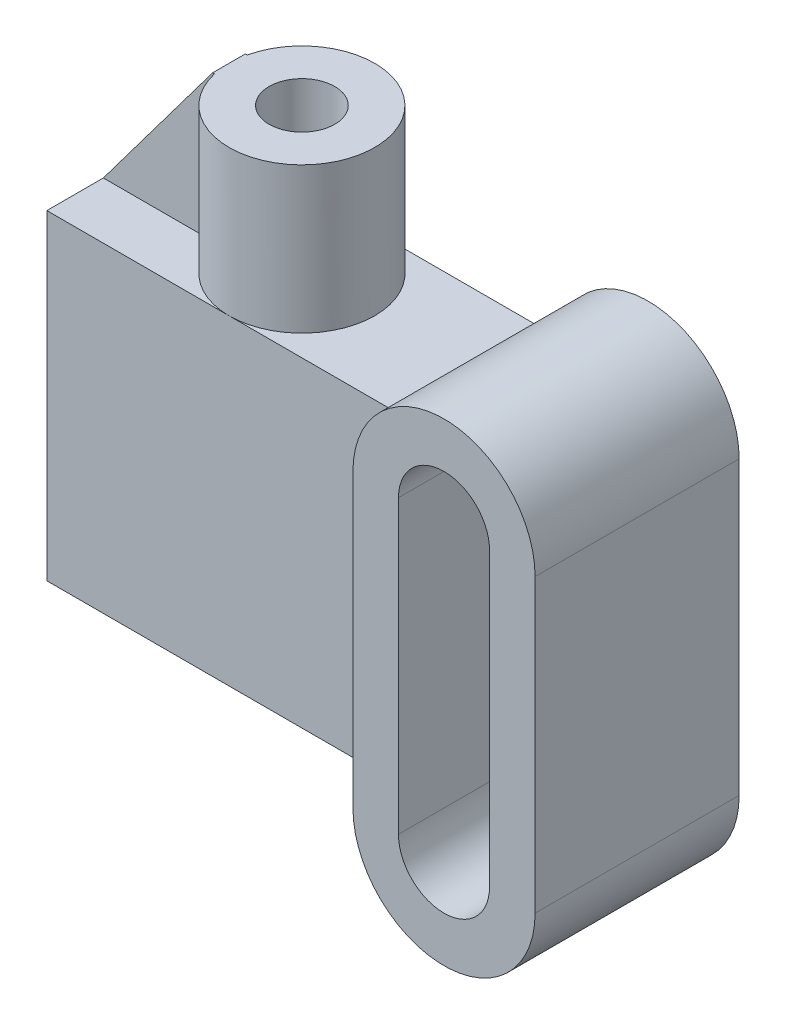
from build123d import *

# Parameters (mm, degrees)
BOSS_EXTRUDE1_DEPTH        = 56
BOSS_EXTRUDE2_START        = -0.322075
BOSS_EXTRUDE2_DEPTH        = 100.322075
SKETCH5_R                  = 20
BOSS_EXTRUDE3_DEPTH        = 40
RIB7_START                 = -4.5
RIB7_DEPTH                 = 9
F_12_0MM_DOWEL_HOLE1_D     = 18
F_12_0MM_DOWEL_HOLE1_DEPTH = 32


with BuildPart() as part:
    # Sketch3 → Boss-Extrude1 (new body)
    with BuildSketch(Plane.XY):
        with BuildLine():
            Line((25, 40), (25, -40))
            ThreePointArc((25, -40), (0, -65), (-25, -40))
            Line((-25, -40), (-25, 40))
            ThreePointArc((-25, 40), (0, 65), (25, 40))
        make_face()
        with BuildLine():
            Line((12.5, 40), (12.5, -40))
            ThreePointArc((12.5, -40), (0, -52.5), (-12.5, -40))
            Line((-12.5, -40), (-12.5, 40))
            ThreePointArc((-12.5, 40), (0, 52.5), (12.5, 40))
        make_face(mode=Mode.SUBTRACT)
    extrude(amount=BOSS_EXTRUDE1_DEPTH)

    # Sketch4 → Boss-Extrude2 (add)
    with BuildSketch(Plane.ZY.offset(25).offset(BOSS_EXTRUDE2_START)):
        Polygon((12, 22), (0, 22), (0, 44), (40, 44), (40, -44), (0, -44), (0, -22), (12, -22), (12, -32), (28, -32), (28, 32), (12, 32), align=None)
    extrude(amount=BOSS_EXTRUDE2_DEPTH)

    # Sketch5 → Boss-Extrude3 (add)
    with BuildSketch(Plane(origin=(0, 44, 0), x_dir=(1, 0, 0), z_dir=(0, 1, 0))):
        with Locations(Location((-75, -20, 0), (0, 0, 270))):
            Circle(SKETCH5_R)
    extrude(amount=BOSS_EXTRUDE3_DEPTH)

    # Rib7: read off the stored shape, not the designer's step
    # Rib7 outline → Rib7 (add)
    with BuildSketch(Plane.XY.offset(20).offset(RIB7_START)):
        Polygon((-125, 44), (-94.48717527, 44), (-94.48717527, 84), (-95, 84), align=None)
    extrude(amount=RIB7_DEPTH)

    # Ø12.0mm Dowel Hole1
    with Locations(Plane(origin=(-75, 84, 20), x_dir=(0, 0, 1), z_dir=(0, 1, 0))):
        with Locations((0, 0)):
            Hole(F_12_0MM_DOWEL_HOLE1_D / 2, depth=F_12_0MM_DOWEL_HOLE1_DEPTH)


solid = part.part
